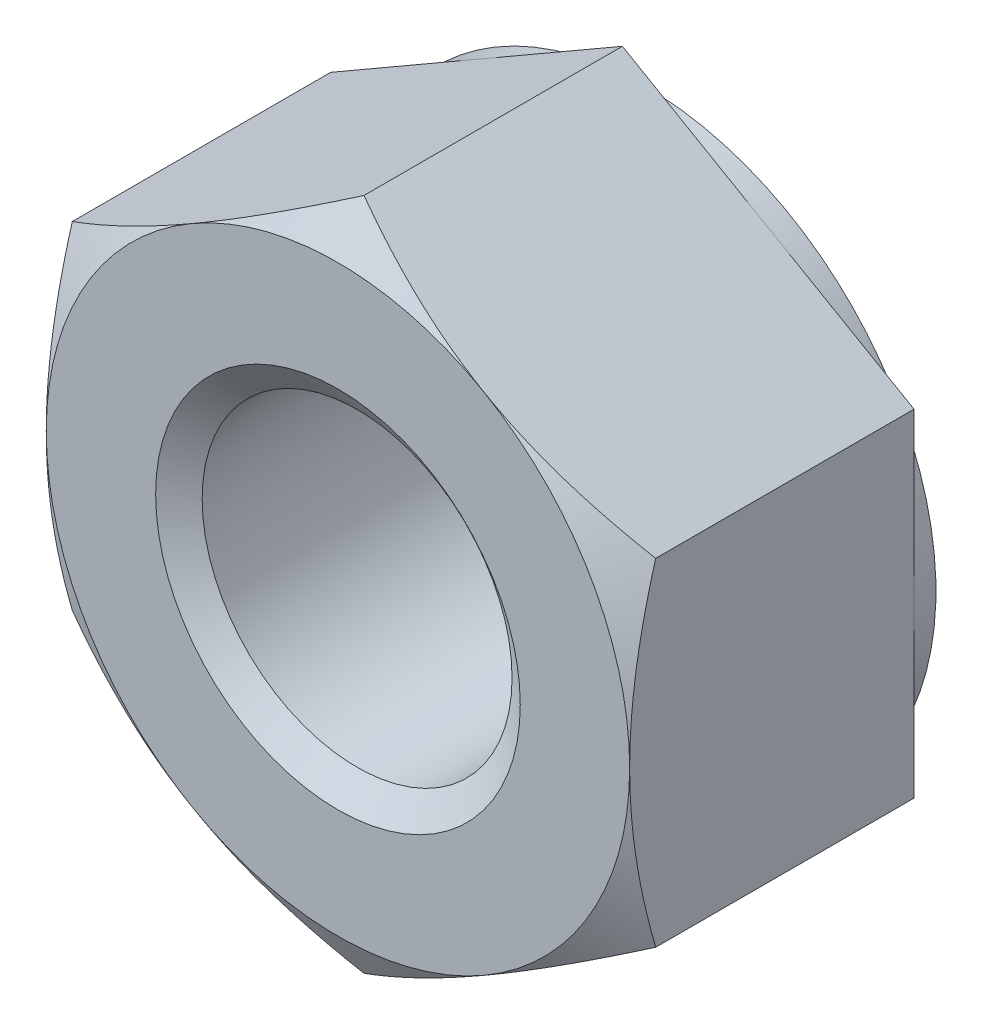
from build123d import *

# Parameters (mm, degrees)
BASENUT_START = -8.4
BASENUTSKE_R  = 4.25
BASENUT_DEPTH = 8.4
SKETCH4_W     = 0.6
SKETCH4_H     = 11.237604307


# Read off the part's stored shape, not the designer's step: ThreadSchematic
with BuildPart() as part:
    # BaseNutSke → BaseNut (new body)
    with BuildSketch(Plane.XY.offset(BASENUT_START)):
        Polygon((8, 4.618802154), (8, -4.618802154), (0, -9.237604307), (-8, -4.618802154), (-8, 4.618802154), (0, 9.237604307), align=None)
        Circle(BASENUTSKE_R, mode=Mode.SUBTRACT)
    extrude(amount=BASENUT_DEPTH)

    # Sketch5 (on Front Plane) → EndChamfer (revolve, cut)
    with BuildSketch(Plane.XY):
        Polygon((8.3746, 5), (7.796928781, 4.175), (8.4254, 4.175), (8.4254, 5), align=None)
    revolve(axis=Axis((8.3746, 5, 0), (-0.5735764363510462, -0.8191520442889919, 0)), mode=Mode.SUBTRACT)

    # Sketch4 → Bearing-Face (revolve, cut)
    with BuildSketch(Plane(origin=(0, 0, 0), x_dir=(0, 0, -1), z_dir=(1, 0, 0)), mode=Mode.PRIVATE) as bearing_face_sk:
        with Locations((8.1, 13.618802154)):
            Rectangle(SKETCH4_W, SKETCH4_H)
        Polygon((0, 8), (-10, 8), (-10, 19.237604307), (0.71453118, 19.237604307), (0.71453118, 9.237604307), align=None)
    revolve(bearing_face_sk.sketch.rotate(Axis((0, 0, 0), (0, 0, -1)), 270), axis=Axis((0, 0, 0), (0, 0, -1)), mode=Mode.SUBTRACT)

    # ThreadSchematic outline → ThreadSchematic (revolve, cut)
    with BuildSketch(Plane.XZ):
        Polygon((4.25, 0), (4.25, -0.525155654), (5, 0), align=None)
        Polygon((5, -8.3746), (4.25, -7.849444346), (4.25, -8.4), (5, -8.4), align=None)
    revolve(axis=Axis((0, 0, 0), (0, 0, 1)), mode=Mode.SUBTRACT)


solid = part.part
